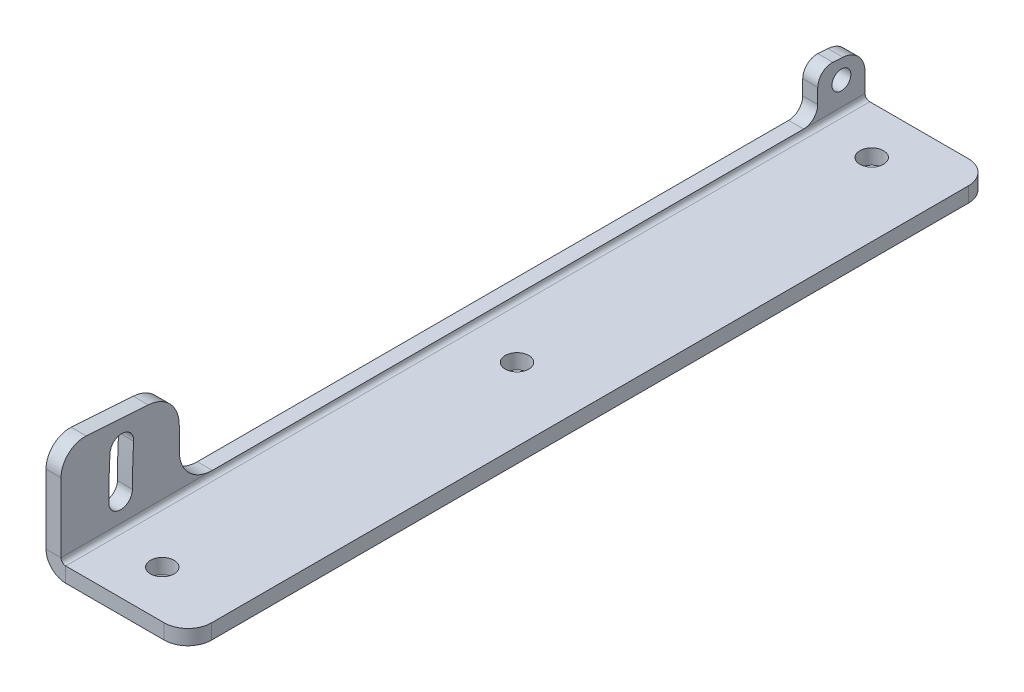
from build123d import *

# Parameters (mm, degrees)
BASE_FLANGE1_DEPTH = 170
FILLET1_R          = 5
SKETCH6_R          = 2
CUT_EXTRUDE1_DEPTH = 178.200451467
SKETCH7_R          = 2.5
CUT_EXTRUDE2_DEPTH = 178.200451467
CUT_EXTRUDE3_DEPTH = 178.200451467
FILLET2_R          = 5
CUT_EXTRUDE4_DEPTH = 175.263907966
FILLET3_R          = 3
FILLET4_R          = 7


# Sheet-metal steps are written as plain solids
with BuildPart() as part:
    # Sketch1 → Base-Flange1 (new body)
    with BuildSketch(Plane.XY):
        with BuildLine():
            Line((0, 0), (-25.825, 0))
            ThreePointArc((-25.825, 0), (-28.777170811, 1.222829189), (-30, 4.175))
            Line((-30, 4.175), (-30, 40))
            Line((-30, 40), (-26.825, 40))
            Line((-26.825, 40), (-26.825, 4.175))
            ThreePointArc((-26.825, 4.175), (-26.532106781, 3.467893219), (-25.825, 3.175))
            Line((-25.825, 3.175), (0, 3.175))
            Line((0, 3.175), (0, 0))
        make_face()
    extrude(amount=BASE_FLANGE1_DEPTH)

    # Fillet1
    fillet1_edges = [part.edges().sort_by_distance(p)[0] for p in [
        (0, 1.5875, 170),
        (0, 1.5875, 0),
        (-28.4125, 40, 170),
        (-28.4125, 40, 0),
    ]]
    fillet(fillet1_edges, radius=FILLET1_R)

    # Sketch6 → Cut-Extrude1 (cut, through all)
    with BuildSketch(Plane.ZY.offset(30)):
        with Locations((5, 9.175)):
            Circle(SKETCH6_R)
        with BuildLine():
            ThreePointArc((159.9, 9.175), (159.835005505, 13.661766133), (159.640076561, 18.14476706))
            ThreePointArc((159.640076561, 18.14476706), (156.999504521, 20.49580498), (154.648466601, 17.85523294))
            ThreePointArc((154.648466601, 17.85523294), (154.837103455, 13.516938304), (154.9, 9.175))
            ThreePointArc((154.9, 9.175), (157.4, 6.675), (159.9, 9.175))
        make_face()
    extrude(amount=-CUT_EXTRUDE1_DEPTH, mode=Mode.SUBTRACT)

    # Sketch7 → Cut-Extrude2 (cut, through all)
    with BuildSketch(Plane.XZ):
        with Locations(Location((-15.4125, 160, 0), (0, 0, 270))):
            Circle(SKETCH7_R)
        with Locations(Location((-15.4125, 85, 0), (0, 0, 270))):
            Circle(SKETCH7_R)
        with Locations(Location((-15.4125, 10, 0), (0, 0, 270))):
            Circle(SKETCH7_R)
    extrude(amount=-CUT_EXTRUDE2_DEPTH, mode=Mode.SUBTRACT)

    # Sketch8 → Cut-Extrude3 (cut, through all)
    with BuildSketch(Plane.ZY.offset(30)):
        with BuildLine():
            Line((0, 12.85080004), (170, 24.175))
            Line((170, 24.175), (170, 35))
            ThreePointArc((170, 35), (168.535533906, 38.535533906), (165, 40))
            Line((165, 40), (5, 40))
            ThreePointArc((5, 40), (1.464466094, 38.535533906), (0, 35))
            Line((0, 35), (0, 12.85080004))
        make_face()
    extrude(amount=-CUT_EXTRUDE3_DEPTH, mode=Mode.SUBTRACT)

    # Fillet2
    fillet2_edges = [part.edges().sort_by_distance(p)[0] for p in [
        (-28.4125, 24.175, 170),
        (-28.4125, 12.85080004, 0),
    ]]
    fillet(fillet2_edges, radius=FILLET2_R)

    # Sketch9 → Cut-Extrude4 (cut, through all)
    with BuildSketch(Plane.ZY.offset(30)):
        Polygon((10, 13.51692945), (10, 4.175), (145, 4.175), (145, 22.509676476), align=None)
    extrude(amount=-CUT_EXTRUDE4_DEPTH, mode=Mode.SUBTRACT)

    # Fillet3
    fillet3_edges = [part.edges().sort_by_distance(p)[0] for p in [
        (-28.4125, 4.175, 10),
        (-28.4125, 13.51692945, 10),
    ]]
    fillet(fillet3_edges, radius=FILLET3_R)

    # Fillet4
    fillet4_edges = [part.edges().sort_by_distance(p)[0] for p in [
        (-28.4125, 22.509676476, 145),
        (-28.4125, 4.175, 145),
    ]]
    fillet(fillet4_edges, radius=FILLET4_R)


solid = part.part
